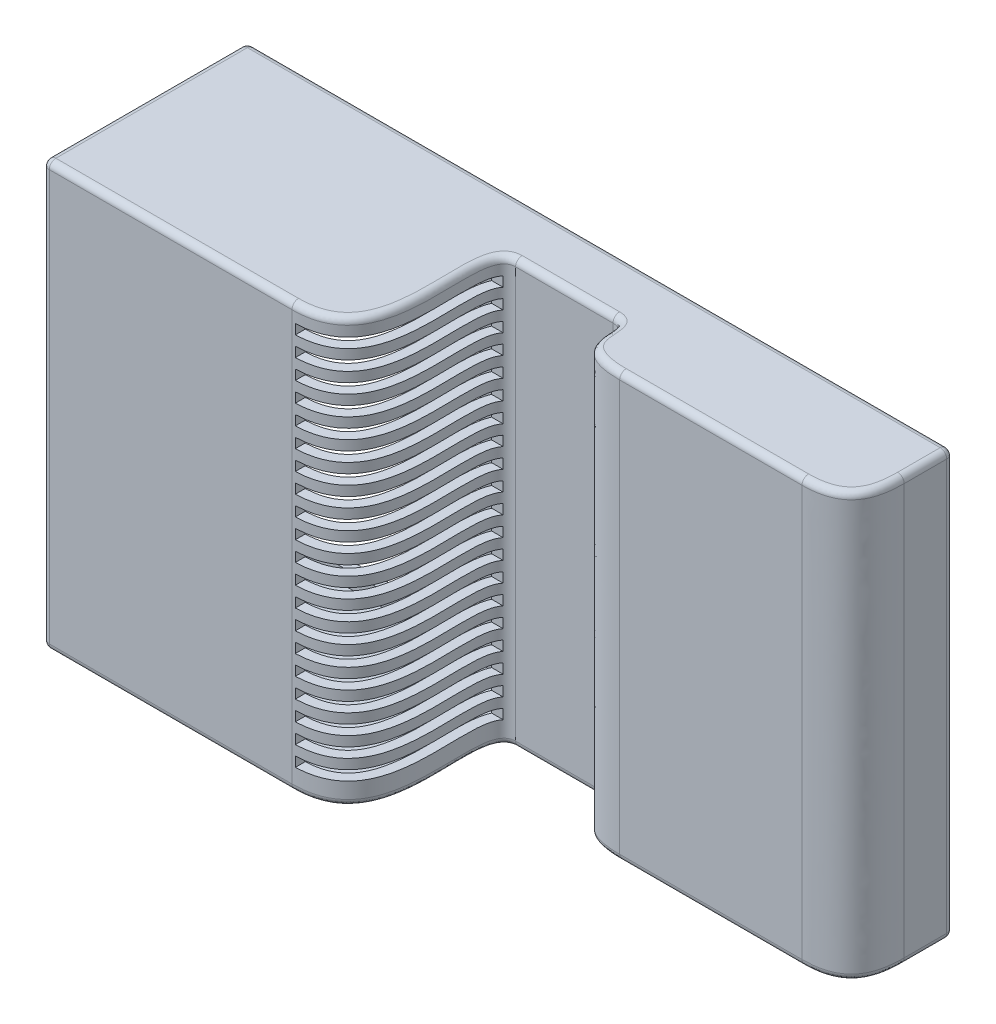
from build123d import *

# Parameters (mm, degrees)
SKETCH1_W         = 107.434326511
SKETCH1_H         = 64.5
SKETCH1_W_2       = 29.49
SKETCH1_H_2       = 57.01
SKETCH1_W_3       = 52.61
SKETCH1_H_3       = 38.72
TOP_DEPTH         = 1.5
SKETCH1_3_W       = 107.434326511
SKETCH1_3_H       = 64.5
SKETCH1_3_W_2     = 104.434326511
SKETCH1_3_H_2     = 61.5
WALLS_DEPTH       = 29.642641204
BOTTOM_START      = 29.642641
SKETCH1_4_W       = 107.434326511
SKETCH1_4_H       = 64.5
BOTTOM_DEPTH      = 1.5
CURVE_CUT_DEPTH   = 111.923132856
CURVED_WALL_DEPTH = 64.5
VENT_CUT_START    = -55
SKETCH2_W         = 23.555622727
SKETCH2_H         = 1.5
VENT_CUT_DEPTH    = 14
BUTTONS_CUT_REACH = 112.471
FILLET1_R         = 1


with BuildPart() as part:
    # Sketch1 → top (new body)
    with BuildSketch(Plane.XY):
        with Locations((31.517836744, -0.005)):
            Rectangle(SKETCH1_W, SKETCH1_H)
        Rectangle(SKETCH1_W_2, SKETCH1_H_2, mode=Mode.SUBTRACT)
        with Locations((50.23, 0)):
            Rectangle(SKETCH1_W_3, SKETCH1_H_3, mode=Mode.SUBTRACT)
    extrude(amount=-TOP_DEPTH)

    # Sketch1<3> → walls (add)
    with BuildSketch(Plane.XY):
        with Locations((31.517836744, -0.005)):
            Rectangle(SKETCH1_3_W, SKETCH1_3_H)
        with Locations((31.517836744, -0.005)):
            Rectangle(SKETCH1_3_W_2, SKETCH1_3_H_2, mode=Mode.SUBTRACT)
    extrude(amount=WALLS_DEPTH)

    # Sketch1<4> → bottom (add)
    with BuildSketch(Plane.XY.offset(BOTTOM_START)):
        with Locations((31.517836744, -0.005)):
            Rectangle(SKETCH1_4_W, SKETCH1_4_H)
    extrude(amount=-BOTTOM_DEPTH)

    # curve_sketch → curve_cut (cut, through all)
    with BuildSketch(Plane(origin=(0, 32.245, 0), x_dir=(1, 0, 0), z_dir=(0, 1, 0))):
        with BuildLine():
            Line((41.929707689, -6.98129646), (27.104963868, -6.98129646))
            add(Edge.make_bspline(
                [(15.739061726, -29.642641204), (31.01247489, -29.642641204), (20.968427882, -6.98129646), (27.104963868, -6.98129646)],
                knots=[0, 0, 0, 0, 1, 1, 1, 1], degree=3))
            Line((15.739061726, -29.642641204), (85.235, -29.642641204))
            Line((85.235, -29.642641204), (85.235, -5.978129985))
            add(Edge.make_bspline(
                [(77.677498745, -13.967929036), (83.959143631, -13.967929036), (85.235, -10.375554586), (85.235, -5.978129985)],
                knots=[0, 0, 0, 0, 1, 1, 1, 1], degree=3))
            Line((77.677498745, -13.967929036), (49.934523837, -13.967929036))
            add(Edge.make_bspline(
                [(41.929707689, -6.98129646), (45.676829846, -6.98129646), (40.053194899, -13.967929036), (49.934523837, -13.967929036)],
                knots=[0, 0, 0, 0, 1, 1, 1, 1], degree=3))
        make_face()
    extrude(amount=-CURVE_CUT_DEPTH, mode=Mode.SUBTRACT)

    # curve_sketch<3> → curved_wall (add)
    with BuildSketch(Plane(origin=(0, 32.245, 0), x_dir=(1, 0, 0), z_dir=(0, 1, 0))):
        with BuildLine():
            add(Edge.make_bspline(
                [(77.677498745, -12.467929036), (77.850422056, -12.467929036), (78.204153337, -12.461548644), (78.847856384, -12.424581865), (79.578461206, -12.335561483), (80.328388684, -12.169540263), (81.175354079, -11.881958017), (81.972811129, -11.423649058), (82.648024216, -10.743308486), (83.150038946, -9.877653524), (83.500658633, -8.784277267), (83.664658337, -7.693152384), (83.725665617, -6.740294303), (83.735, -6.229356328), (83.735, -5.978129985)],
                knots=[0, 0, 0, 0, 0.03125, 0.0625, 0.125, 0.1875, 0.25, 0.375, 0.5, 0.625, 0.75, 0.875, 0.9375, 1, 1, 1, 1], degree=3))
            Line((83.735, -5.978129985), (85.235, -5.978129985))
            add(Edge.make_bspline(
                [(77.677498745, -13.967929036), (83.959143631, -13.967929036), (85.235, -10.375554586), (85.235, -5.978129985)],
                knots=[0, 0, 0, 0, 1, 1, 1, 1], degree=3))
            Line((77.677498745, -13.967929036), (49.934523837, -13.967929036))
            add(Edge.make_bspline(
                [(41.929707689, -6.98129646), (45.676829846, -6.98129646), (40.053194899, -13.967929036), (49.934523837, -13.967929036)],
                knots=[0, 0, 0, 0, 1, 1, 1, 1], degree=3))
            Line((41.929707689, -6.98129646), (27.104963868, -6.98129646))
            add(Edge.make_bspline(
                [(15.739061726, -29.642641204), (31.01247489, -29.642641204), (20.968427882, -6.98129646), (27.104963868, -6.98129646)],
                knots=[0, 0, 0, 0, 1, 1, 1, 1], degree=3))
            Line((15.739061726, -29.642641204), (15.739061726, -28.142641204))
            add(Edge.make_bspline(
                [(15.739061726, -28.142641204), (15.947615195, -28.142641204), (16.374533644, -28.132648426), (17.148498157, -28.07506528), (18.024343771, -27.937163579), (18.923221314, -27.681201061), (19.94671123, -27.236382584), (20.947084395, -26.511548874), (21.8551433, -25.368183417), (22.531901869, -23.923589631), (23.143971129, -21.64078627), (23.418600997, -18.296145768), (23.345122371, -14.811972934), (23.313103676, -12.20282684), (23.366423957, -10.381905907), (23.57469132, -8.72658108), (23.982709995, -7.456971227), (24.621231257, -6.520438395), (25.544510964, -5.722243097), (26.496049694, -5.48129646), (27.104963868, -5.48129646)],
                knots=[0, 0, 0, 0, 0.015625, 0.03125, 0.0625, 0.09375, 0.125, 0.1875, 0.25, 0.3125, 0.375, 0.5, 0.625, 0.6875, 0.75, 0.8125, 0.875, 0.90625, 0.9375, 1, 1, 1, 1], degree=3))
            Line((27.104963868, -5.48129646), (41.929707689, -5.48129646))
            add(Edge.make_bspline(
                [(41.929707689, -5.48129646), (42.279085034, -5.48129646), (42.973630392, -5.556045427), (43.980872294, -6.085101967), (44.60623256, -6.942993265), (44.856808805, -7.745094485), (44.957573275, -8.452994384), (45.015421134, -9.316145824), (45.080085556, -10.279408002), (45.340000054, -11.094658177), (45.707703227, -11.551465825), (46.392430907, -11.950193964), (47.197674, -12.221417699), (48.160146953, -12.384458326), (49.100275847, -12.455239923), (49.664192906, -12.467929036), (49.934523837, -12.467929036)],
                knots=[0, 0, 0, 0, 0.0625, 0.125, 0.1875, 0.25, 0.3125, 0.375, 0.5, 0.625, 0.75, 0.8125, 0.875, 0.9375, 0.96875, 1, 1, 1, 1], degree=3))
            Line((49.934523837, -12.467929036), (77.677498745, -12.467929036))
        make_face()
    extrude(amount=-CURVED_WALL_DEPTH)

    # Sketch2 → vent_cut (cut)
    with BuildSketch(Plane(origin=(85.235, 0, 0), x_dir=(0, 0, -1), z_dir=(1, 0, 0)).offset(VENT_CUT_START)):
        with Locations((-19.31751474, -25.074669214)):
            Rectangle(SKETCH2_W, SKETCH2_H)
        with Locations((-19.31751474, -28.074669214)):
            Rectangle(SKETCH2_W, SKETCH2_H)
        with Locations((-19.31751474, -22.074669214)):
            Rectangle(SKETCH2_W, SKETCH2_H)
        with Locations((-19.31751474, -19.074669214)):
            Rectangle(SKETCH2_W, SKETCH2_H)
        with Locations((-19.31751474, -16.074669214)):
            Rectangle(SKETCH2_W, SKETCH2_H)
        with Locations((-19.31751474, -13.074669214)):
            Rectangle(SKETCH2_W, SKETCH2_H)
        with Locations((-19.31751474, -10.074669214)):
            Rectangle(SKETCH2_W, SKETCH2_H)
        with Locations((-19.31751474, -7.074669214)):
            Rectangle(SKETCH2_W, SKETCH2_H)
        with Locations((-19.31751474, -4.074669214)):
            Rectangle(SKETCH2_W, SKETCH2_H)
        with Locations((-19.31751474, -1.074669214)):
            Rectangle(SKETCH2_W, SKETCH2_H)
        with Locations((-19.31751474, 1.925330786)):
            Rectangle(SKETCH2_W, SKETCH2_H)
        with Locations((-19.31751474, 4.925330786)):
            Rectangle(SKETCH2_W, SKETCH2_H)
        with Locations((-19.31751474, 7.925330786)):
            Rectangle(SKETCH2_W, SKETCH2_H)
        with Locations((-19.31751474, 10.925330786)):
            Rectangle(SKETCH2_W, SKETCH2_H)
        with Locations((-19.31751474, 13.925330786)):
            Rectangle(SKETCH2_W, SKETCH2_H)
        with Locations((-19.31751474, 16.925330786)):
            Rectangle(SKETCH2_W, SKETCH2_H)
        with Locations((-19.31751474, 19.925330786)):
            Rectangle(SKETCH2_W, SKETCH2_H)
        with Locations((-19.31751474, 22.925330786)):
            Rectangle(SKETCH2_W, SKETCH2_H)
        with Locations((-19.31751474, 25.925330786)):
            Rectangle(SKETCH2_W, SKETCH2_H)
        with Locations((-19.31751474, 28.925330786)):
            Rectangle(SKETCH2_W, SKETCH2_H)
    extrude(amount=-VENT_CUT_DEPTH, mode=Mode.SUBTRACT)

    # buttons_sketch → buttons_cut (cut, up to next)
    with BuildSketch(Plane(origin=(0, 30.745, -1.5), x_dir=(-1, 0, 0), z_dir=(0, 0, 1)), mode=Mode.PRIVATE) as buttons_cut_sk1:
        with BuildLine():
            ThreePointArc((-27.79358251, 58.185606146), (-27.889830089, 58.289222765), (-27.993446707, 58.192975186))
            add(Edge.make_bspline(
                [(-27.993446707, 58.192975186), (-28.011484912, 57.703740244), (-28.080062604, 56.696963804), (-28.320531182, 54.928895801), (-28.792987645, 53.06216144), (-29.544514864, 51.536404842), (-30.215054312, 50.989941634), (-30.65952866, 50.964586833), (-31.018420502, 51.130309832), (-31.413653079, 51.560582559), (-31.803573006, 52.279283771), (-32.166794552, 53.297680095), (-32.487558314, 54.624245814), (-32.70974427, 56.004717917), (-32.853377028, 57.262905931), (-32.915164475, 57.974625626), (-32.941024284, 58.320665464)],
                knots=[0, 0, 0, 0, 0.0625, 0.125, 0.25, 0.375, 0.5, 0.5625, 0.625, 0.6875, 0.75, 0.8125, 0.875, 0.9375, 0.96875, 1, 1, 1, 1], degree=3))
            ThreePointArc((-32.941024284, 58.320665464), (-33.048198506, 58.412935102), (-33.140468144, 58.30576088))
            add(Edge.make_bspline(
                [(-27.79358251, 58.185606146), (-28.096103379, 49.980589249), (-32.275408043, 46.73006586), (-33.140468144, 58.30576088)],
                knots=[0, 0, 0, 0, 1, 1, 1, 1], degree=3))
        make_face()
    buttons_cut_tool1 = extrude(buttons_cut_sk1.sketch, amount=BUTTONS_CUT_REACH, mode=Mode.PRIVATE) & part.part
    # buttons_sketch → buttons_cut (cut, up to next)
    with BuildSketch(Plane(origin=(0, 30.745, -1.5), x_dir=(-1, 0, 0), z_dir=(0, 0, 1)), mode=Mode.PRIVATE) as buttons_cut_sk2:
        with BuildLine():
            ThreePointArc((-47.79358251, 58.185606146), (-47.889830089, 58.289222765), (-47.993446707, 58.192975186))
            add(Edge.make_bspline(
                [(-47.993446707, 58.192975186), (-48.011484912, 57.703740243), (-48.080062604, 56.696963804), (-48.320531182, 54.928895801), (-48.792987645, 53.06216144), (-49.544514864, 51.536404842), (-50.215054312, 50.989941634), (-50.65952866, 50.964586833), (-51.018420502, 51.130309832), (-51.413653079, 51.560582559), (-51.803573006, 52.279283771), (-52.166794552, 53.297680095), (-52.487558314, 54.624245814), (-52.70974427, 56.004717917), (-52.853377028, 57.262905931), (-52.915164475, 57.974625626), (-52.941024284, 58.320665464)],
                knots=[0, 0, 0, 0, 0.0625, 0.125, 0.25, 0.375, 0.5, 0.5625, 0.625, 0.6875, 0.75, 0.8125, 0.875, 0.9375, 0.96875, 1, 1, 1, 1], degree=3))
            ThreePointArc((-52.941024284, 58.320665464), (-53.048198506, 58.412935102), (-53.140468144, 58.30576088))
            add(Edge.make_bspline(
                [(-47.79358251, 58.185606146), (-48.096103379, 49.980589249), (-52.275408043, 46.73006586), (-53.140468144, 58.30576088)],
                knots=[0, 0, 0, 0, 1, 1, 1, 1], degree=3))
        make_face()
    buttons_cut_tool2 = extrude(buttons_cut_sk2.sketch, amount=BUTTONS_CUT_REACH, mode=Mode.PRIVATE) & part.part
    # buttons_sketch → buttons_cut (cut, up to next)
    with BuildSketch(Plane(origin=(0, 30.745, -1.5), x_dir=(-1, 0, 0), z_dir=(0, 0, 1)), mode=Mode.PRIVATE) as buttons_cut_sk3:
        with BuildLine():
            ThreePointArc((-67.79358251, 58.185606146), (-67.889830089, 58.289222765), (-67.993446707, 58.192975186))
            add(Edge.make_bspline(
                [(-67.993446707, 58.192975186), (-68.011484912, 57.703740243), (-68.080062604, 56.696963804), (-68.320531182, 54.928895801), (-68.792987645, 53.06216144), (-69.544514864, 51.536404842), (-70.215054312, 50.989941634), (-70.65952866, 50.964586833), (-71.018420502, 51.130309832), (-71.413653079, 51.560582559), (-71.803573006, 52.279283771), (-72.166794552, 53.297680095), (-72.487558314, 54.624245814), (-72.70974427, 56.004717917), (-72.853377028, 57.262905931), (-72.915164475, 57.974625626), (-72.941024284, 58.320665464)],
                knots=[0, 0, 0, 0, 0.0625, 0.125, 0.25, 0.375, 0.5, 0.5625, 0.625, 0.6875, 0.75, 0.8125, 0.875, 0.9375, 0.96875, 1, 1, 1, 1], degree=3))
            ThreePointArc((-72.941024284, 58.320665464), (-73.048198506, 58.412935102), (-73.140468144, 58.30576088))
            add(Edge.make_bspline(
                [(-67.79358251, 58.185606146), (-68.096103379, 49.980589249), (-72.275408043, 46.73006586), (-73.140468144, 58.30576088)],
                knots=[0, 0, 0, 0, 1, 1, 1, 1], degree=3))
        make_face()
    buttons_cut_tool3 = extrude(buttons_cut_sk3.sketch, amount=BUTTONS_CUT_REACH, mode=Mode.PRIVATE) & part.part
    # buttons_sketch → buttons_cut (cut, up to next)
    with BuildSketch(Plane(origin=(0, 30.745, -1.5), x_dir=(-1, 0, 0), z_dir=(0, 0, 1)), mode=Mode.PRIVATE) as buttons_cut_sk4:
        with BuildLine():
            ThreePointArc((-73.140468144, 3.19423912), (-73.048198506, 3.087064898), (-72.941024284, 3.179334536))
            add(Edge.make_bspline(
                [(-67.993446707, 3.307024814), (-68.011484912, 3.796259757), (-68.080062604, 4.803036196), (-68.320531182, 6.571104199), (-68.792987645, 8.43783856), (-69.544514864, 9.963595158), (-70.215054312, 10.510058366), (-70.65952866, 10.535413167), (-71.018420502, 10.369690168), (-71.413653079, 9.939417441), (-71.803573006, 9.220716229), (-72.166794552, 8.202319905), (-72.487558314, 6.875754186), (-72.70974427, 5.495282083), (-72.853377028, 4.237094069), (-72.915164475, 3.525374374), (-72.941024284, 3.179334536)],
                knots=[0, 0, 0, 0, 0.0625, 0.125, 0.25, 0.375, 0.5, 0.5625, 0.625, 0.6875, 0.75, 0.8125, 0.875, 0.9375, 0.96875, 1, 1, 1, 1], degree=3))
            ThreePointArc((-67.993446707, 3.307024814), (-67.889830089, 3.210777235), (-67.79358251, 3.314393854))
            add(Edge.make_bspline(
                [(-67.79358251, 3.314393854), (-68.096103379, 11.519410751), (-72.275408043, 14.76993414), (-73.140468144, 3.19423912)],
                knots=[0, 0, 0, 0, 1, 1, 1, 1], degree=3))
        make_face()
    buttons_cut_tool4 = extrude(buttons_cut_sk4.sketch, amount=BUTTONS_CUT_REACH, mode=Mode.PRIVATE) & part.part
    # buttons_sketch → buttons_cut (cut, up to next)
    with BuildSketch(Plane(origin=(0, 30.745, -1.5), x_dir=(-1, 0, 0), z_dir=(0, 0, 1)), mode=Mode.PRIVATE) as buttons_cut_sk5:
        with BuildLine():
            ThreePointArc((-53.140468144, 3.19423912), (-53.048198506, 3.087064898), (-52.941024284, 3.179334536))
            add(Edge.make_bspline(
                [(-47.993446707, 3.307024814), (-48.011484912, 3.796259757), (-48.080062604, 4.803036196), (-48.320531182, 6.571104199), (-48.792987645, 8.43783856), (-49.544514864, 9.963595158), (-50.215054312, 10.510058366), (-50.65952866, 10.535413167), (-51.018420502, 10.369690168), (-51.413653079, 9.939417441), (-51.803573006, 9.220716229), (-52.166794552, 8.202319905), (-52.487558314, 6.875754186), (-52.70974427, 5.495282083), (-52.853377028, 4.237094069), (-52.915164475, 3.525374374), (-52.941024284, 3.179334536)],
                knots=[0, 0, 0, 0, 0.0625, 0.125, 0.25, 0.375, 0.5, 0.5625, 0.625, 0.6875, 0.75, 0.8125, 0.875, 0.9375, 0.96875, 1, 1, 1, 1], degree=3))
            ThreePointArc((-47.993446707, 3.307024814), (-47.889830089, 3.210777235), (-47.79358251, 3.314393854))
            add(Edge.make_bspline(
                [(-47.79358251, 3.314393854), (-48.096103379, 11.519410751), (-52.275408043, 14.76993414), (-53.140468144, 3.19423912)],
                knots=[0, 0, 0, 0, 1, 1, 1, 1], degree=3))
        make_face()
    buttons_cut_tool5 = extrude(buttons_cut_sk5.sketch, amount=BUTTONS_CUT_REACH, mode=Mode.PRIVATE) & part.part
    # buttons_sketch → buttons_cut (cut, up to next)
    with BuildSketch(Plane(origin=(0, 30.745, -1.5), x_dir=(-1, 0, 0), z_dir=(0, 0, 1)), mode=Mode.PRIVATE) as buttons_cut_sk6:
        with BuildLine():
            ThreePointArc((-33.140468144, 3.19423912), (-33.048198506, 3.087064898), (-32.941024284, 3.179334536))
            add(Edge.make_bspline(
                [(-27.993446707, 3.307024814), (-28.011484912, 3.796259756), (-28.080062604, 4.803036196), (-28.320531182, 6.571104199), (-28.792987645, 8.43783856), (-29.544514864, 9.963595158), (-30.215054312, 10.510058366), (-30.65952866, 10.535413167), (-31.018420502, 10.369690168), (-31.413653079, 9.939417441), (-31.803573006, 9.220716229), (-32.166794552, 8.202319905), (-32.487558314, 6.875754186), (-32.70974427, 5.495282083), (-32.853377028, 4.237094069), (-32.915164475, 3.525374374), (-32.941024284, 3.179334536)],
                knots=[0, 0, 0, 0, 0.0625, 0.125, 0.25, 0.375, 0.5, 0.5625, 0.625, 0.6875, 0.75, 0.8125, 0.875, 0.9375, 0.96875, 1, 1, 1, 1], degree=3))
            ThreePointArc((-27.993446707, 3.307024814), (-27.889830089, 3.210777235), (-27.79358251, 3.314393854))
            add(Edge.make_bspline(
                [(-27.79358251, 3.314393854), (-28.096103379, 11.519410751), (-32.275408043, 14.76993414), (-33.140468144, 3.19423912)],
                knots=[0, 0, 0, 0, 1, 1, 1, 1], degree=3))
        make_face()
    buttons_cut_tool6 = extrude(buttons_cut_sk6.sketch, amount=BUTTONS_CUT_REACH, mode=Mode.PRIVATE) & part.part
    add(buttons_cut_tool1.solids().sort_by_distance((30.54913, -20.130398, -1.5))[0], mode=Mode.SUBTRACT)
    add(buttons_cut_tool2.solids().sort_by_distance((47.893263, -27.451105, -1.5))[0], mode=Mode.SUBTRACT)
    add(buttons_cut_tool3.solids().sort_by_distance((70.54913, -20.130398, -1.5))[0], mode=Mode.SUBTRACT)
    add(buttons_cut_tool4.solids().sort_by_distance((73.041254, 27.565013, -1.5))[0], mode=Mode.SUBTRACT)
    add(buttons_cut_tool5.solids().sort_by_distance((50.54913, 20.120398, -1.5))[0], mode=Mode.SUBTRACT)
    add(buttons_cut_tool6.solids().sort_by_distance((33.041254, 27.565013, -1.5))[0], mode=Mode.SUBTRACT)

    # Fillet1
    fillet1_edges = [part.edges().sort_by_distance(p)[0] for p in [
        (34.517335779, -32.255, 6.98129646),
        (63.806011291, -32.255, 13.967929036),
        (31.517836744, 32.245, -1.5),
        (-22.199326511, -0.005, -1.5),
        (31.517836744, -32.255, -1.5),
        (85.235, -32.255, 2.239064993),
        (-22.199326511, -32.255, 14.071320551),
        (-22.199326511, 32.245, 14.071320551),
        (85.235, 32.245, 2.239064993),
        (-22.199326511, -0.005, 29.642641204),
        (85.235, -0.005, -1.5),
        (-3.230132393, 32.245, 29.642641204),
        (-3.230132393, -32.255, 29.642641204),
        (34.517335779, 32.245, 6.98129646),
        (63.806011291, 32.245, 13.967929036),
    ]]
    fillet(fillet1_edges, radius=FILLET1_R)


solid = part.part
